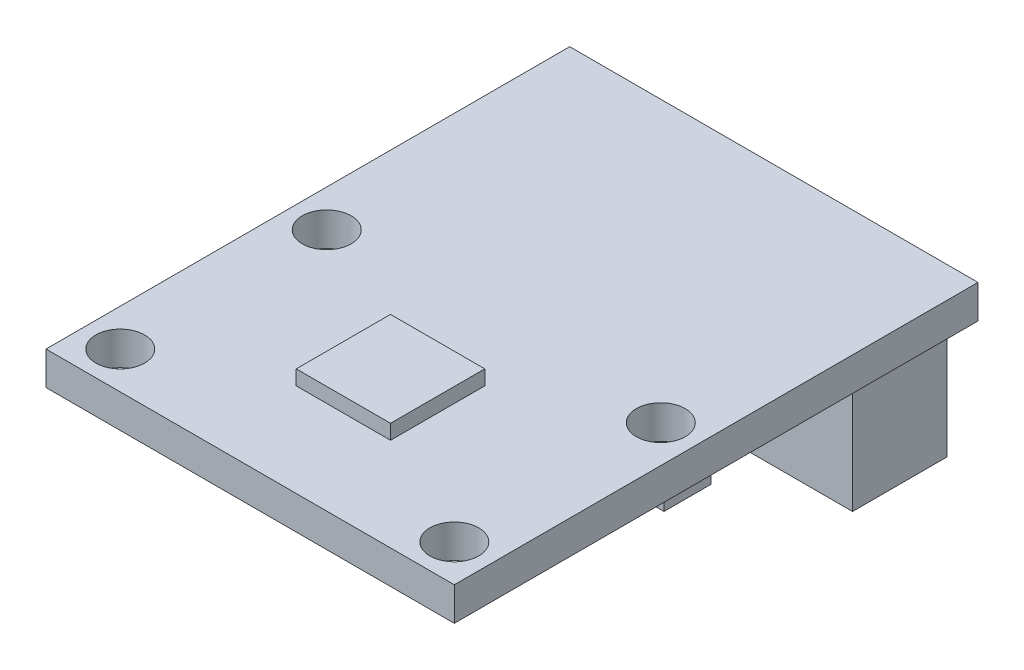
from build123d import *

# Parameters (mm, degrees)
SKETCH1_W           = 22
SKETCH1_H           = 28.216692514
SKETCH1_R           = 1.315
BOSS_EXTRUDE1_DEPTH = 1.8
SKETCH2_W           = 5.08
SKETCH2_H           = 5.08
BOSS_EXTRUDE2_DEPTH = 0.79375
SKETCH3_W           = 7.62
SKETCH3_H           = 2.54
SKETCH3_W_2         = 20.32
SKETCH3_H_2         = 5.08
BOSS_EXTRUDE3_DEPTH = 6.35


with BuildPart() as part:
    # Sketch1 → Boss-Extrude1 (new body)
    with BuildSketch(Plane(origin=(0, 0, 0), x_dir=(1, 0, 0), z_dir=(0, 1, 0))):
        with Locations((0, 6.545846257)):
            Rectangle(SKETCH1_W, SKETCH1_H)
        with Locations((-9, 5.5625)):
            Circle(SKETCH1_R, mode=Mode.SUBTRACT)
        with Locations((9, 5.5625)):
            Circle(SKETCH1_R, mode=Mode.SUBTRACT)
        with Locations((9, -5.5625)):
            Circle(SKETCH1_R, mode=Mode.SUBTRACT)
        with Locations((-9, -5.5625)):
            Circle(SKETCH1_R, mode=Mode.SUBTRACT)
    extrude(amount=BOSS_EXTRUDE1_DEPTH)

    # Sketch2 → Boss-Extrude2 (add)
    with BuildSketch(Plane(origin=(0, 1.8, 0), x_dir=(1, 0, 0), z_dir=(0, 1, 0))):
        Rectangle(SKETCH2_W, SKETCH2_H)
    extrude(amount=BOSS_EXTRUDE2_DEPTH)

    # Sketch3 → Boss-Extrude3 (add)
    with BuildSketch(Plane(origin=(0, 0, 0), x_dir=(-1, 0, 0), z_dir=(0, -1, 0))):
        with Locations((-1.27, 10.924192514)):
            Rectangle(SKETCH3_W, SKETCH3_H)
        with Locations((0, 17.274192514)):
            Rectangle(SKETCH3_W_2, SKETCH3_H_2)
    extrude(amount=BOSS_EXTRUDE3_DEPTH)


solid = part.part
